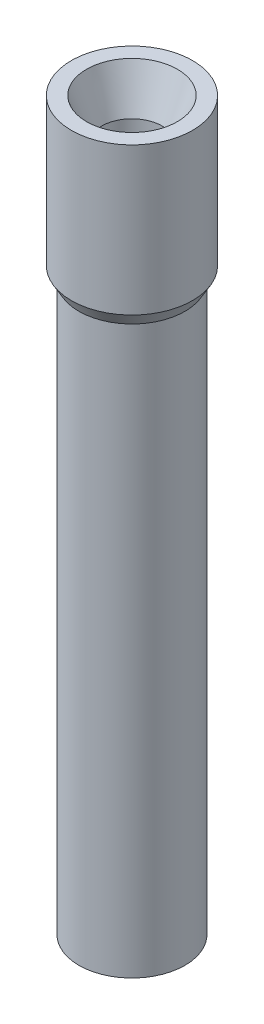
from build123d import *

# Parameters (mm, degrees)
SKETCH_1_R          = 4
EXTRUDE_1_DEPTH     = 8
SKETCH_2_R          = 3.5
EXTRUDE_2_DEPTH     = 40
CHAMFER_1_SIZE      = 1.5
CHAMFER_1_SIZE_2    = 2.598076211
SKETCH_3_R          = 2
CUT_EXTRUDE_1_DEPTH = 101
CHAMFER_2_SIZE      = 1
CHAMFER_2_SIZE2     = 2.747477419


with BuildPart() as part:
    # 草图1 → 凸台-拉伸1 (new body)
    with BuildSketch(Plane(origin=(0, 0, 0), x_dir=(1, 0, 0), z_dir=(0, 1, 0))):
        with Locations(Location((0, 0, 0), (0, 0, 270))):
            Circle(SKETCH_1_R)
    extrude(amount=EXTRUDE_1_DEPTH)

    # 草图2 → 凸台-拉伸2 (add)
    with BuildSketch(Plane.XZ):
        with Locations(Location((0, 0, 0), (0, 0, 270))):
            Circle(SKETCH_2_R)
    extrude(amount=EXTRUDE_2_DEPTH)

    # 倒角1
    # the kernel refuses this chamfer: 2.598076211, 1.5 mm, written as the material it adds along each edge
    with BuildSketch(Plane(origin=(0, 0, 0), x_dir=(0, 0, -1), z_dir=(-1, 0, 0))) as chamfer_1_piece_1_section:
        Polygon((3.5 + CHAMFER_1_SIZE, 0), (3.5, CHAMFER_1_SIZE_2), (3.5, 0), align=None)
    chamfer_1_piece_1 = revolve(axis=Axis((0, 0, 0), (0, -1, 0)), mode=Mode.PRIVATE)
    chamfer_1_piece_1 = chamfer_1_piece_1 & Plane(origin=(0, -2.194625368, 0), x_dir=(0, 0, 1), z_dir=(0, -1, 0)) * Cylinder(4, 20, mode=Mode.PRIVATE)
    add(chamfer_1_piece_1)

    # 草图3 → 切除-拉伸1 (cut)
    with BuildSketch(Plane.XZ.offset(40)):
        with Locations(Location((0, 0, 0), (0, 0, 270))):
            Circle(SKETCH_3_R)
    extrude(amount=-CUT_EXTRUDE_1_DEPTH, mode=Mode.SUBTRACT)

    # 倒角2
    chamfer_2_edges = [part.edges().sort_by_distance(p)[0] for p in [
        (0, 8, 2),
    ]]
    chamfer_2_side = [part.faces().sort_by_distance(p)[0] for p in [
        (0, 8, -3.886862915),
    ]]
    chamfer(chamfer_2_edges, length=CHAMFER_2_SIZE, length2=CHAMFER_2_SIZE2, reference=chamfer_2_side[0])


solid = part.part
